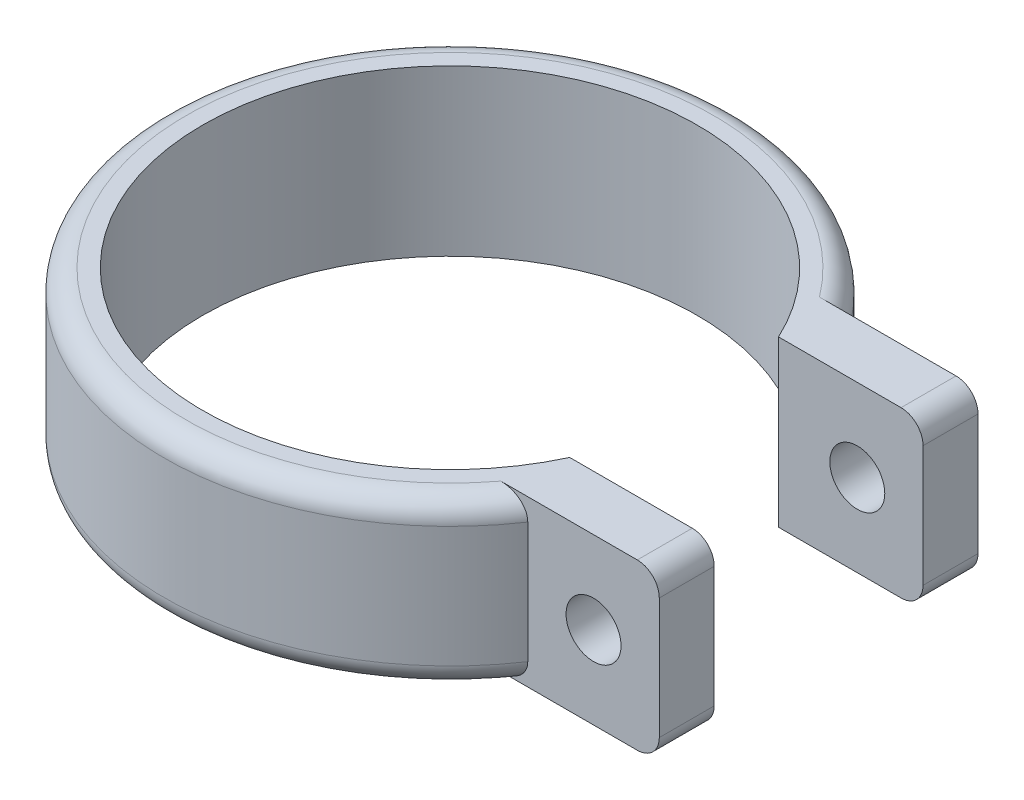
from build123d import *

# Parameters (mm, degrees)
SALIENTE_EXTRUIR1_DEPTH = 15
REDONDEO1_R             = 2
CROQUIS2_R              = 2.5
CORTAR_EXTRUIR1_DEPTH   = 73


# Read off the part's stored shape, not the designer's step: Saliente-Extruir1
with BuildPart() as part:
    # Saliente-Extruir1 outline → Saliente-Extruir1 (new body)
    with BuildSketch(Plane(origin=(0, 0, 0), x_dir=(1, 0, 0), z_dir=(0, 1, 0))):
        with BuildLine():
            Line((33.547312235, 9.5), (33.547312235, 14.5))
            Line((33.547312235, 14.5), (21.581241855, 14.5))
            ThreePointArc((21.581241855, 14.5), (-26, 0), (21.581241855, -14.5))
            Line((21.581241855, -14.5), (33.547312235, -14.5))
            Line((33.547312235, -14.5), (33.547312235, -9.5))
            Line((33.547312235, -9.5), (20.396078054, -9.5))
            ThreePointArc((20.396078054, -9.5), (-22.5, 0), (20.396078054, 9.5))
            Line((20.396078054, 9.5), (33.547312235, 9.5))
        make_face()
    extrude(amount=SALIENTE_EXTRUIR1_DEPTH)

    # Redondeo1
    redondeo1_edges = [part.edges().sort_by_distance(p)[0] for p in [
        (-26, 0, 0),
        (33.547312235, 0, -12),
        (-26, 15, 0),
        (33.547312235, 15, 12),
        (33.547312235, 15, -12),
        (33.547312235, 0, 12),
    ]]
    fillet(redondeo1_edges, radius=REDONDEO1_R)

    # Croquis2 → Cortar-Extruir1 (cut)
    with BuildSketch(Plane.XY.offset(14.5)):
        with Locations((27.564277045, 7.5)):
            Circle(CROQUIS2_R)
    extrude(amount=-CORTAR_EXTRUIR1_DEPTH, mode=Mode.SUBTRACT)


solid = part.part
